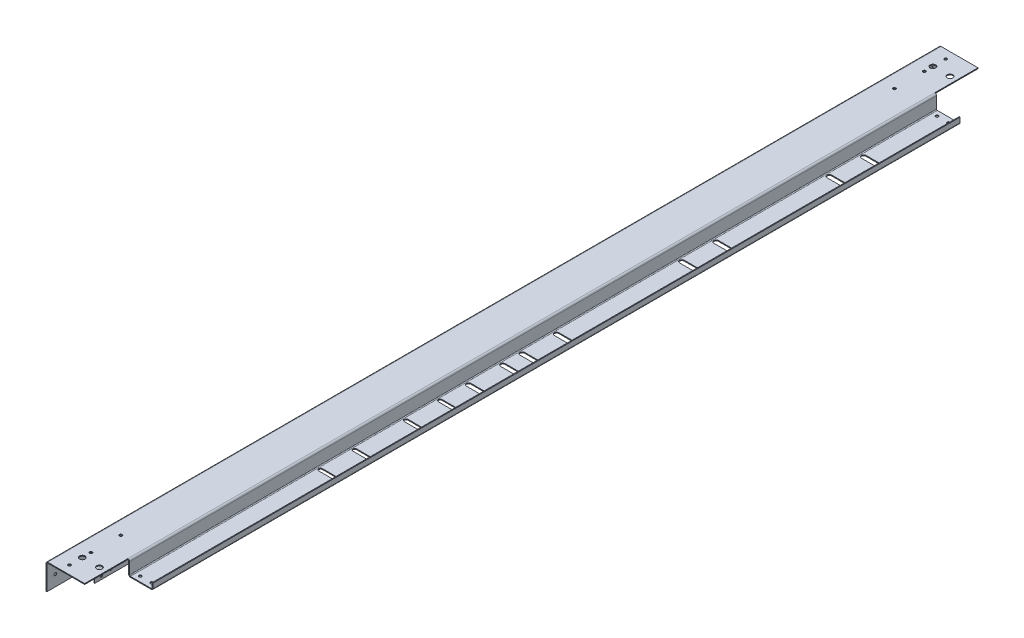
from build123d import *

# Parameters (mm, degrees)
SM_BASE_FLANGE_1_DEPTH = 1045
SKETCH_6_W             = 17
SKETCH_6_H             = 97
CUT_EXTRUDE_1_DEPTH    = 24
SKETCH_7_W             = 101
SKETCH_7_H             = 35
CUT_EXTRUDE_2_DEPTH    = 59
CUT_EXTRUDE_3_DEPTH    = 10
CUT_EXTRUDE_3227_DEPTH = 10
SKETCH_10_R            = 3.25
SKETCH_10_R_2          = 6.5
CUT_EXTRUDE_5_DEPTH    = 10
SKETCH_11_R            = 2.5
CUT_EXTRUDE_6_DEPTH    = 10
SKETCH_12_R            = 3.25
CUT_EXTRUDE_7_DEPTH    = 10
SKETCH_13_R            = 2.5
CUT_EXTRUDE_8_DEPTH    = 10


# Sheet-metal steps are written as plain solids
with BuildPart() as part:
    # Sketch 1 → Базовая кромка1 (new, symmetric)
    with BuildSketch(Plane.XY):
        with BuildLine():
            Line((0, 0), (0, 18))
            ThreePointArc((0, 18), (-0.585786438, 19.414213562), (-2, 20))
            Line((-2, 20), (-11, 20))
            ThreePointArc((-11, 20), (-13.828427125, 21.171572875), (-15, 24))
            Line((-15, 24), (-15, 81))
            ThreePointArc((-15, 81), (-13.828427125, 83.828427125), (-11, 85))
            Line((-11, 85), (75.5, 85))
            ThreePointArc((75.5, 85), (78.328427125, 83.828427125), (79.5, 81))
            Line((79.5, 81), (79.5, 54))
            ThreePointArc((79.5, 54), (80.085786438, 52.585786438), (81.5, 52))
            Line((81.5, 52), (130.5, 52))
            ThreePointArc((130.5, 52), (131.914213562, 52.585786438), (132.5, 54))
            Line((132.5, 54), (132.5, 65))
            Line((132.5, 65), (134.5, 65))
            Line((134.5, 65), (134.5, 54))
            ThreePointArc((134.5, 54), (133.328427125, 51.171572875), (130.5, 50))
            Line((130.5, 50), (81.5, 50))
            ThreePointArc((81.5, 50), (78.671572875, 51.171572875), (77.5, 54))
            Line((77.5, 54), (77.5, 81))
            ThreePointArc((77.5, 81), (76.914213562, 82.414213562), (75.5, 83))
            Line((75.5, 83), (-11, 83))
            ThreePointArc((-11, 83), (-12.414213562, 82.414213562), (-13, 81))
            Line((-13, 81), (-13, 24))
            ThreePointArc((-13, 24), (-12.414213562, 22.585786438), (-11, 22))
            Line((-11, 22), (-2, 22))
            ThreePointArc((-2, 22), (0.828427125, 20.828427125), (2, 18))
            Line((2, 18), (2, 0))
            Line((2, 0), (0, 0))
        make_face()
    extrude(amount=SM_BASE_FLANGE_1_DEPTH, both=True)

    # Эскиз6 → Вырез-Вытянуть1 (cut)
    with BuildSketch(Plane.XZ):
        with Locations((-6.5, 996.5)):
            Rectangle(SKETCH_6_W, SKETCH_6_H)
        with Locations((-6.5, -996.5)):
            Rectangle(SKETCH_6_W, SKETCH_6_H)
    extrude(amount=-CUT_EXTRUDE_1_DEPTH, mode=Mode.SUBTRACT)

    # Эскиз7 → Вырез-Вытянуть2 (cut)
    with BuildSketch(Plane(origin=(134.5, 0, 0), x_dir=(0, 0, -1), z_dir=(1, 0, 0))):
        with Locations((994.5, 67.5)):
            Rectangle(SKETCH_7_W, SKETCH_7_H)
        with Locations((-994.5, 67.5)):
            Rectangle(SKETCH_7_W, SKETCH_7_H)
    extrude(amount=-CUT_EXTRUDE_2_DEPTH, mode=Mode.SUBTRACT)

    # Эскиз8 → Вырез-Вытянуть3 (cut)
    with BuildSketch(Plane.ZY.offset(15)):
        with BuildLine():
            Line((-5.5, 38), (-5.5, 67))
            ThreePointArc((-5.5, 67), (0, 72.5), (5.5, 67))
            Line((5.5, 67), (5.5, 38))
            ThreePointArc((5.5, 38), (0, 32.5), (-5.5, 38))
        make_face()
        with BuildLine():
            Line((-860.5, 38), (-860.5, 67))
            ThreePointArc((-860.5, 67), (-855, 72.5), (-849.5, 67))
            Line((-849.5, 67), (-849.5, 38))
            ThreePointArc((-849.5, 38), (-855, 32.5), (-860.5, 38))
        make_face()
        with BuildLine():
            Line((849.5, 38), (849.5, 67))
            ThreePointArc((849.5, 67), (855, 72.5), (860.5, 67))
            Line((860.5, 67), (860.5, 38))
            ThreePointArc((860.5, 38), (855, 32.5), (849.5, 38))
        make_face()
    extrude(amount=-CUT_EXTRUDE_3_DEPTH, mode=Mode.SUBTRACT)

    # Эскиз9 → Cut-Extrude 3227 (cut)
    with BuildSketch(Plane.XZ.offset(-50)):
        with BuildLine():
            Line((88, 430), (124, 430))
            ThreePointArc((124, 430), (128.5, 425.5), (124, 421))
            Line((124, 421), (88, 421))
            ThreePointArc((88, 421), (83.5, 425.5), (88, 430))
        make_face()
        with BuildLine():
            Line((88, 230), (124, 230))
            ThreePointArc((124, 230), (128.5, 225.5), (124, 221))
            Line((124, 221), (88, 221))
            ThreePointArc((88, 221), (83.5, 225.5), (88, 230))
        make_face()
        with BuildLine():
            Line((89, 165.5), (123, 165.5))
            ThreePointArc((123, 165.5), (128.5, 160), (123, 154.5))
            Line((123, 154.5), (89, 154.5))
            ThreePointArc((89, 154.5), (83.5, 160), (89, 165.5))
        make_face()
        with BuildLine():
            Line((88, 310), (124, 310))
            ThreePointArc((124, 310), (128.5, 305.5), (124, 301))
            Line((124, 301), (88, 301))
            ThreePointArc((88, 301), (83.5, 305.5), (88, 310))
        make_face()
        with BuildLine():
            Line((89, 85.5), (123, 85.5))
            ThreePointArc((123, 85.5), (128.5, 80), (123, 74.5))
            Line((123, 74.5), (89, 74.5))
            ThreePointArc((89, 74.5), (83.5, 80), (89, 85.5))
        make_face()
        with BuildLine():
            Line((89, 40), (123, 40))
            ThreePointArc((123, 40), (128.5, 34.5), (123, 29))
            Line((123, 29), (89, 29))
            ThreePointArc((89, 29), (83.5, 34.5), (89, 40))
        make_face()
        with BuildLine():
            Line((89, -40), (123, -40))
            ThreePointArc((123, -40), (128.5, -45.5), (123, -51))
            Line((123, -51), (89, -51))
            ThreePointArc((89, -51), (83.5, -45.5), (89, -40))
        make_face()
        with BuildLine():
            Line((89, -333.5), (123, -333.5))
            ThreePointArc((123, -333.5), (128.5, -339), (123, -344.5))
            Line((123, -344.5), (89, -344.5))
            ThreePointArc((89, -344.5), (83.5, -339), (89, -333.5))
        make_face()
        with BuildLine():
            Line((89, -413.5), (123, -413.5))
            ThreePointArc((123, -413.5), (128.5, -419), (123, -424.5))
            Line((123, -424.5), (89, -424.5))
            ThreePointArc((89, -424.5), (83.5, -419), (89, -413.5))
        make_face()
        with BuildLine():
            Line((89, -678.5), (123, -678.5))
            ThreePointArc((123, -678.5), (128.5, -684), (123, -689.5))
            Line((123, -689.5), (89, -689.5))
            ThreePointArc((89, -689.5), (83.5, -684), (89, -678.5))
        make_face()
        with BuildLine():
            Line((89, -758.5), (123, -758.5))
            ThreePointArc((123, -758.5), (128.5, -764), (123, -769.5))
            Line((123, -769.5), (89, -769.5))
            ThreePointArc((89, -769.5), (83.5, -764), (89, -758.5))
        make_face()
        with BuildLine():
            Line((88, 510), (124, 510))
            ThreePointArc((124, 510), (128.5, 505.5), (124, 501))
            Line((124, 501), (88, 501))
            ThreePointArc((88, 501), (83.5, 505.5), (88, 510))
        make_face()
    extrude(amount=-CUT_EXTRUDE_3227_DEPTH, mode=Mode.SUBTRACT)

    # Эскиз10 → Вырез-Вытянуть5 (cut)
    with BuildSketch(Plane(origin=(0, 85, 0), x_dir=(1, 0, 0), z_dir=(0, 1, 0))):
        with Locations(Location((20, 1025, 0), (0, 0, 180))):
            Circle(SKETCH_10_R)
        with Locations(Location((20, 995, 0), (0, 0, 180))):
            Circle(SKETCH_10_R_2)
        with Locations(Location((20, 975, 0), (0, 0, 180))):
            Circle(SKETCH_10_R)
        with Locations(Location((60, 995, 0), (0, 0, 180))):
            Circle(SKETCH_10_R_2)
        with Locations(Location((20, 905, 0), (0, 0, 180))):
            Circle(SKETCH_10_R)
        with Locations((20, -905)):
            Circle(SKETCH_10_R)
        with Locations((60, -995)):
            Circle(SKETCH_10_R_2)
        with Locations((20, -975)):
            Circle(SKETCH_10_R)
        with Locations((20, -995)):
            Circle(SKETCH_10_R_2)
        with Locations((20, -1025)):
            Circle(SKETCH_10_R)
    cut_extrude_5 = extrude(amount=-CUT_EXTRUDE_5_DEPTH, mode=Mode.SUBTRACT)

    # Зеркальное отражение1: Вырез-Вытянуть5 across plane
    add(cut_extrude_5.mirror(Plane(origin=(35, 35, 0), x_dir=(0, 0, 1), z_dir=(-0.7071067811865499, -0.7071067811865452, 0))), mode=Mode.SUBTRACT)

    # Эскиз11 → Вырез-Вытянуть6 (cut)
    with BuildSketch(Plane.ZY):
        with Locations((-932, 7)):
            Circle(SKETCH_11_R)
        with Locations((932, 7)):
            Circle(SKETCH_11_R)
    extrude(amount=-CUT_EXTRUDE_6_DEPTH, mode=Mode.SUBTRACT)

    # Эскиз12 → Вырез-Вытянуть7 (cut)
    with BuildSketch(Plane.XZ.offset(-50)):
        with Locations((92.5, 932)):
            Circle(SKETCH_12_R)
        with Locations((119.5, 932)):
            Circle(SKETCH_12_R)
        with Locations(Location((119.5, -932, 0), (0, 0, 180))):
            Circle(SKETCH_12_R)
        with Locations(Location((92.5, -932, 0), (0, 0, 180))):
            Circle(SKETCH_12_R)
    extrude(amount=-CUT_EXTRUDE_7_DEPTH, mode=Mode.SUBTRACT)

    # Эскиз13 → Вырез-Вытянуть8 (cut)
    with BuildSketch(Plane(origin=(2, 0, 0), x_dir=(0, 0, -1), z_dir=(1, 0, 0))):
        with Locations((910, 10)):
            Circle(SKETCH_13_R)
        with Locations((860, 10)):
            Circle(SKETCH_13_R)
        with Locations((825, 10)):
            Circle(SKETCH_13_R)
        with Locations((-860, 10)):
            Circle(SKETCH_13_R)
        with Locations((-910, 10)):
            Circle(SKETCH_13_R)
        with Locations((775, 10)):
            Circle(SKETCH_13_R)
        with Locations((725, 10)):
            Circle(SKETCH_13_R)
        with Locations((675, 10)):
            Circle(SKETCH_13_R)
        with Locations((625, 10)):
            Circle(SKETCH_13_R)
        with Locations((575, 10)):
            Circle(SKETCH_13_R)
        with Locations((525, 10)):
            Circle(SKETCH_13_R)
        with Locations((475, 10)):
            Circle(SKETCH_13_R)
        with Locations((425, 10)):
            Circle(SKETCH_13_R)
        with Locations((375, 10)):
            Circle(SKETCH_13_R)
        with Locations((325, 10)):
            Circle(SKETCH_13_R)
        with Locations((275, 10)):
            Circle(SKETCH_13_R)
        with Locations((225, 10)):
            Circle(SKETCH_13_R)
        with Locations((175, 10)):
            Circle(SKETCH_13_R)
        with Locations((125, 10)):
            Circle(SKETCH_13_R)
        with Locations((75, 10)):
            Circle(SKETCH_13_R)
        with Locations((25, 10)):
            Circle(SKETCH_13_R)
        with Locations((-25, 10)):
            Circle(SKETCH_13_R)
        with Locations((-75, 10)):
            Circle(SKETCH_13_R)
        with Locations((-125, 10)):
            Circle(SKETCH_13_R)
        with Locations((-175, 10)):
            Circle(SKETCH_13_R)
        with Locations((-225, 10)):
            Circle(SKETCH_13_R)
        with Locations((-275, 10)):
            Circle(SKETCH_13_R)
        with Locations((-325, 10)):
            Circle(SKETCH_13_R)
        with Locations((-375, 10)):
            Circle(SKETCH_13_R)
        with Locations((-425, 10)):
            Circle(SKETCH_13_R)
        with Locations((-475, 10)):
            Circle(SKETCH_13_R)
        with Locations((-525, 10)):
            Circle(SKETCH_13_R)
        with Locations((-575, 10)):
            Circle(SKETCH_13_R)
        with Locations((-625, 10)):
            Circle(SKETCH_13_R)
        with Locations((-675, 10)):
            Circle(SKETCH_13_R)
        with Locations((-725, 10)):
            Circle(SKETCH_13_R)
        with Locations((-775, 10)):
            Circle(SKETCH_13_R)
        with Locations((-825, 10)):
            Circle(SKETCH_13_R)
    extrude(amount=-CUT_EXTRUDE_8_DEPTH, mode=Mode.SUBTRACT)


solid = part.part
